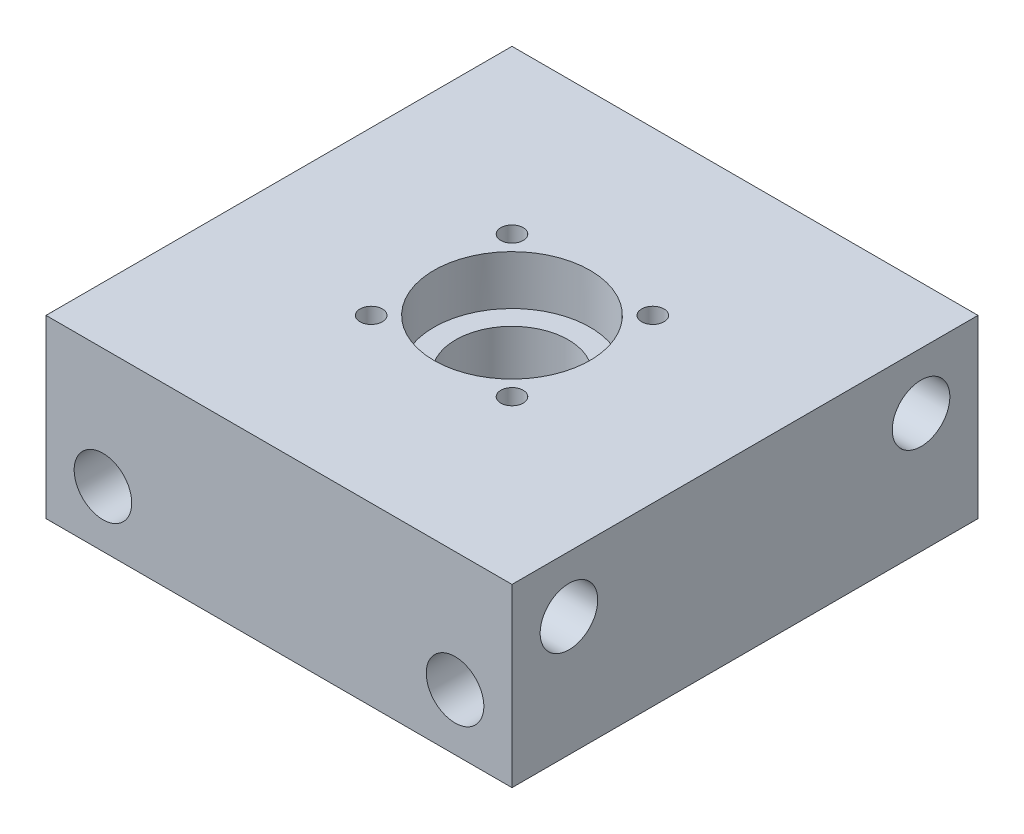
from build123d import *

# Parameters (mm, degrees)
SKETCH1_W           = 66.175
SKETCH1_H           = 66.175
SKETCH1_R           = 11.0875
SKETCH1_R_2         = 1.5875
BOSS_EXTRUDE1_DEPTH = 25
SKETCH1_4_R         = 8
BOSS_EXTRUDE2_DEPTH = 18
SKETCH2_R           = 4.0875
CUT_EXTRUDE1_DEPTH  = 79.095539445
SKETCH3_R           = 4.0875
CUT_EXTRUDE2_DEPTH  = 79.095539445
SKETCH1_5_R         = 1.5875
CUT_EXTRUDE3_DEPTH  = 16.833


with BuildPart() as part:
    # Sketch1 → Boss-Extrude1 (new body)
    with BuildSketch(Plane(origin=(0, 0, 0), x_dir=(1, 0, 0), z_dir=(0, 1, 0))):
        Rectangle(SKETCH1_W, SKETCH1_H)
        Circle(SKETCH1_R, mode=Mode.SUBTRACT)
        with Locations((10, 10)):
            Circle(SKETCH1_R_2, mode=Mode.SUBTRACT)
        with Locations((-10, 10)):
            Circle(SKETCH1_R_2, mode=Mode.SUBTRACT)
        with Locations((-10, -10)):
            Circle(SKETCH1_R_2, mode=Mode.SUBTRACT)
        with Locations((10, -10)):
            Circle(SKETCH1_R_2, mode=Mode.SUBTRACT)
    extrude(amount=BOSS_EXTRUDE1_DEPTH)

    # Sketch1<4> → Boss-Extrude2 (add)
    with BuildSketch(Plane(origin=(0, 0, 0), x_dir=(1, 0, 0), z_dir=(0, 1, 0))):
        with BuildLine():
            ThreePointArc((11.0875, 0), (10.410859382, 3.814008807), (8.463524679, 7.1625))
            Line((8.463524679, 7.1625), (8.361768611, 7.1625))
            Line((8.361768611, 7.1625), (8.168552872, 7.497159478))
            ThreePointArc((8.168552872, 7.497159478), (0, 11.0875), (-8.168552872, 7.497159478))
            Line((-8.168552872, 7.497159478), (-8.361768611, 7.1625))
            Line((-8.361768611, 7.1625), (-8.463524679, 7.1625))
            ThreePointArc((-8.463524679, 7.1625), (-11.0875, 0), (-8.463524679, -7.1625))
            Line((-8.463524679, -7.1625), (-8.361768611, -7.1625))
            Line((-8.361768611, -7.1625), (-8.168552872, -7.497159478))
            ThreePointArc((-8.168552872, -7.497159478), (0, -11.0875), (8.168552872, -7.497159478))
            Line((8.168552872, -7.497159478), (8.361768611, -7.1625))
            Line((8.361768611, -7.1625), (8.463524679, -7.1625))
            ThreePointArc((8.463524679, -7.1625), (10.410859382, -3.814008807), (11.0875, 0))
        make_face()
        Circle(SKETCH1_4_R, mode=Mode.SUBTRACT)
    extrude(amount=BOSS_EXTRUDE2_DEPTH)

    # Sketch2 → Cut-Extrude1 (cut, through all)
    with BuildSketch(Plane.ZY.offset(33.0875)):
        with Locations((-25, 17)):
            Circle(SKETCH2_R)
        with Locations((25, 17)):
            Circle(SKETCH2_R)
    extrude(amount=-CUT_EXTRUDE1_DEPTH, mode=Mode.SUBTRACT)

    # Sketch3 → Cut-Extrude2 (cut, through all)
    with BuildSketch(Plane(origin=(0, 0, -33.0875), x_dir=(-1, 0, 0), z_dir=(0, 0, -1))):
        with Locations((-25, 8)):
            Circle(SKETCH3_R)
        with Locations((25, 8)):
            Circle(SKETCH3_R)
    extrude(amount=-CUT_EXTRUDE2_DEPTH, mode=Mode.SUBTRACT)

    # Sketch1<5> → Cut-Extrude3 (cut)
    # profile 1 of 4: a face of its own
    with BuildSketch(Plane(origin=(0, 0, 0), x_dir=(1, 0, 0), z_dir=(0, 1, 0))):
        with BuildLine():
            Line((11.638231389, 7.1625), (13.276462778, 10))
            Line((13.276462778, 10), (11.638231389, 12.8375))
            Line((11.638231389, 12.8375), (8.361768611, 12.8375))
            Line((8.361768611, 12.8375), (6.723537222, 10))
            Line((6.723537222, 10), (8.168552872, 7.497159478))
            ThreePointArc((8.168552872, 7.497159478), (8.317722053, 7.331313395), (8.463524679, 7.1625))
            Line((8.463524679, 7.1625), (11.638231389, 7.1625))
        make_face()
        with Locations((10, 10)):
            Circle(SKETCH1_5_R, mode=Mode.SUBTRACT)
    # profile 2 of 4: a face of its own
    with BuildSketch(Plane(origin=(0, 0, 0), x_dir=(1, 0, 0), z_dir=(0, 1, 0))):
        with BuildLine():
            Line((11.638231389, -7.1625), (8.463524679, -7.1625))
            ThreePointArc((8.463524679, -7.1625), (8.317722053, -7.331313395), (8.168552872, -7.497159478))
            Line((8.168552872, -7.497159478), (6.723537222, -10))
            Line((6.723537222, -10), (8.361768611, -12.8375))
            Line((8.361768611, -12.8375), (11.638231389, -12.8375))
            Line((11.638231389, -12.8375), (13.276462778, -10))
            Line((13.276462778, -10), (11.638231389, -7.1625))
        make_face()
        with Locations((10, -10)):
            Circle(SKETCH1_5_R, mode=Mode.SUBTRACT)
    # profile 3 of 4: a face of its own
    with BuildSketch(Plane(origin=(0, 0, 0), x_dir=(1, 0, 0), z_dir=(0, 1, 0))):
        with BuildLine():
            ThreePointArc((-8.463524679, 7.1625), (-8.317722053, 7.331313395), (-8.168552872, 7.497159478))
            Line((-8.168552872, 7.497159478), (-6.723537222, 10))
            Line((-6.723537222, 10), (-8.361768611, 12.8375))
            Line((-8.361768611, 12.8375), (-11.638231389, 12.8375))
            Line((-11.638231389, 12.8375), (-13.276462778, 10))
            Line((-13.276462778, 10), (-11.638231389, 7.1625))
            Line((-11.638231389, 7.1625), (-8.463524679, 7.1625))
        make_face()
        with Locations((-10, 10)):
            Circle(SKETCH1_5_R, mode=Mode.SUBTRACT)
    # profile 4 of 4: a face of its own
    with BuildSketch(Plane(origin=(0, 0, 0), x_dir=(1, 0, 0), z_dir=(0, 1, 0))):
        with BuildLine():
            Line((-6.723537222, -10), (-8.168552872, -7.497159478))
            ThreePointArc((-8.168552872, -7.497159478), (-8.317722053, -7.331313395), (-8.463524679, -7.1625))
            Line((-8.463524679, -7.1625), (-11.638231389, -7.1625))
            Line((-11.638231389, -7.1625), (-13.276462778, -10))
            Line((-13.276462778, -10), (-11.638231389, -12.8375))
            Line((-11.638231389, -12.8375), (-8.361768611, -12.8375))
            Line((-8.361768611, -12.8375), (-6.723537222, -10))
        make_face()
        with Locations((-10, -10)):
            Circle(SKETCH1_5_R, mode=Mode.SUBTRACT)
    extrude(amount=CUT_EXTRUDE3_DEPTH, mode=Mode.SUBTRACT)


solid = part.part
